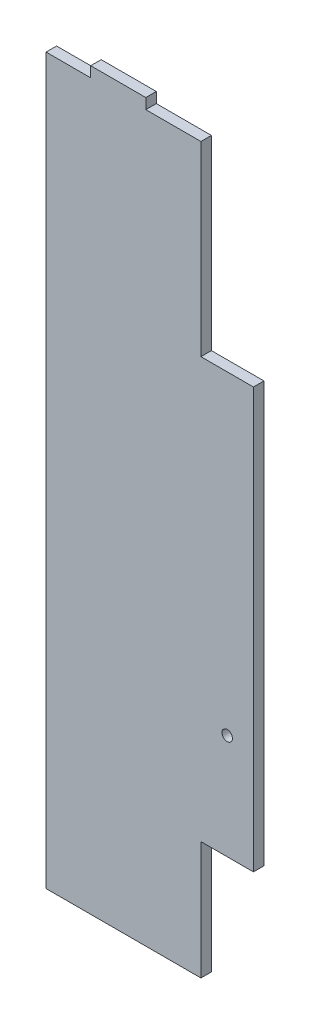
from build123d import *

# Parameters (mm, degrees)
SKETCH1_R           = 2
BOSS_EXTRUDE1_DEPTH = 4


with BuildPart() as part:
    # Sketch1 → Boss-Extrude1 (new body)
    with BuildSketch(Plane.XY):
        Polygon((19, 65), (19, 136), (-2, 136), (-2, 140), (-23, 140), (-23, 136), (-40, 136), (-40, -140), (19, -140), (19, -95), (39, -95), (39, 65), align=None)
        with Locations((29, -55)):
            Circle(SKETCH1_R, mode=Mode.SUBTRACT)
    extrude(amount=BOSS_EXTRUDE1_DEPTH)


solid = part.part
